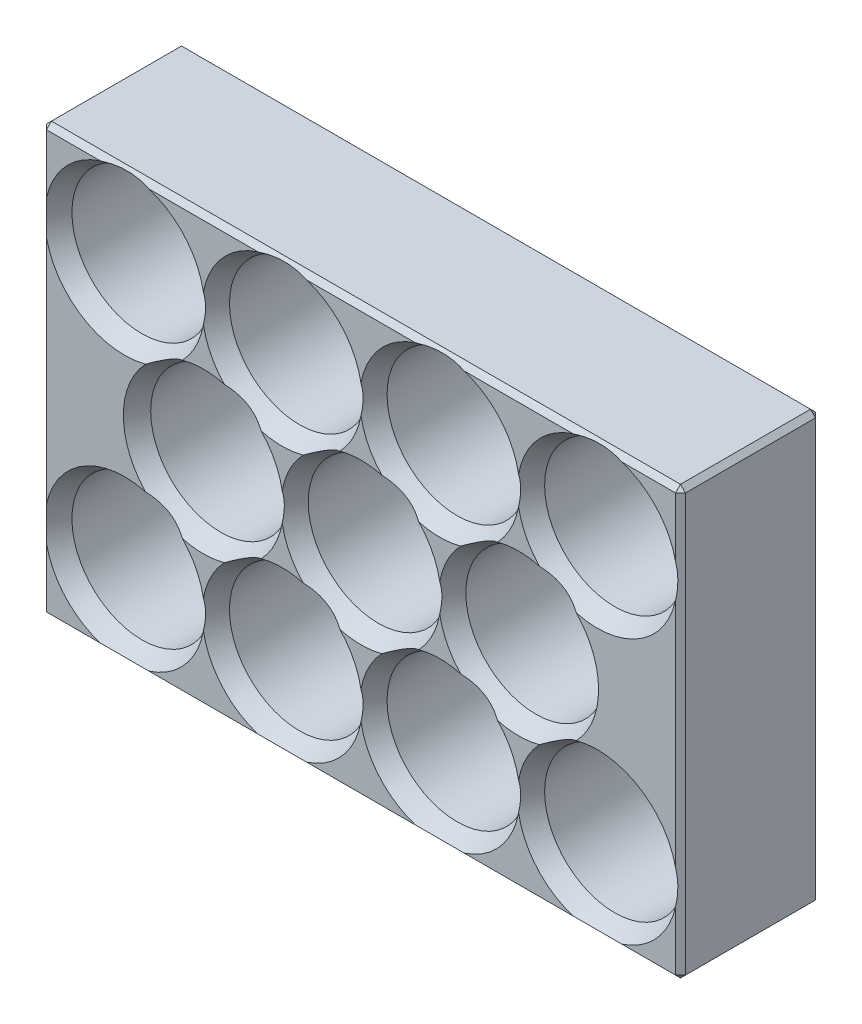
from build123d import *

# Parameters (mm, degrees)
ESQUISSE1_W             = 127.76
ESQUISSE1_H             = 85.48
BOSS_EXTRU_1_DEPTH      = 28
ESQUISSE2_R             = 14
ENL_V_MAT_EXTRU_1_DEPTH = 25
CHANFREIN1_SIZE         = 2
CHANFREIN1_SIZE_2       = 3.464101615


with BuildPart() as part:
    # Esquisse1 → Boss.-Extru.1 (new body)
    with BuildSketch(Plane.XY):
        with Locations((63.88, 42.74)):
            Rectangle(ESQUISSE1_W, ESQUISSE1_H)
    extrude(amount=BOSS_EXTRU_1_DEPTH)

    # Esquisse2 → Enlèv. mat.-Extru.1 (cut)
    with BuildSketch(Plane.XY.offset(28)):
        with Locations((111.13, 69.24)):
            Circle(ESQUISSE2_R)
        with Locations((79.63, 69.24)):
            Circle(ESQUISSE2_R)
        with Locations((48.13, 69.24)):
            Circle(ESQUISSE2_R)
        with Locations((16.63, 69.24)):
            Circle(ESQUISSE2_R)
        with Locations((32.38, 42.74)):
            Circle(ESQUISSE2_R)
        with Locations((16.63, 16.24)):
            Circle(ESQUISSE2_R)
        with Locations((48.13, 16.24)):
            Circle(ESQUISSE2_R)
        with Locations((111.13, 16.24)):
            Circle(ESQUISSE2_R)
        with Locations((79.63, 16.24)):
            Circle(ESQUISSE2_R)
        with Locations((63.88, 42.74)):
            Circle(ESQUISSE2_R)
        with Locations((95.38, 42.74)):
            Circle(ESQUISSE2_R)
    extrude(amount=-ENL_V_MAT_EXTRU_1_DEPTH, mode=Mode.SUBTRACT)

    # Chanfrein1
    # the kernel refuses this chamfer: 3.464101615, 2 mm, written as the material it takes off along each edge
    with BuildSketch(Plane(origin=(79.63, 69.24, 28), x_dir=(1, 0, 0), z_dir=(0, -1, 0))) as chanfrein1_piece_1:
        Polygon((14 + CHANFREIN1_SIZE, 0), (14, -CHANFREIN1_SIZE_2), (14, 0), align=None)
    revolve(axis=Axis((79.63, 69.24, 28), (0, 0, 1)), mode=Mode.SUBTRACT)
    with BuildSketch(Plane(origin=(111.13, 69.24, 28), x_dir=(1, 0, 0), z_dir=(0, -1, 0))) as chanfrein1_piece_2:
        Polygon((14 + CHANFREIN1_SIZE, 0), (14, -CHANFREIN1_SIZE_2), (14, 0), align=None)
    revolve(axis=Axis((111.13, 69.24, 28), (0, 0, 1)), mode=Mode.SUBTRACT)
    with BuildSketch(Plane(origin=(63.88, 42.74, 28), x_dir=(1, 0, 0), z_dir=(0, -1, 0))) as chanfrein1_piece_3:
        Polygon((14 + CHANFREIN1_SIZE, 0), (14, -CHANFREIN1_SIZE_2), (14, 0), align=None)
    revolve(axis=Axis((63.88, 42.74, 28), (0, 0, 1)), mode=Mode.SUBTRACT)
    with BuildSketch(Plane(origin=(95.38, 42.74, 28), x_dir=(1, 0, 0), z_dir=(0, -1, 0))) as chanfrein1_piece_4:
        Polygon((14 + CHANFREIN1_SIZE, 0), (14, -CHANFREIN1_SIZE_2), (14, 0), align=None)
    revolve(axis=Axis((95.38, 42.74, 28), (0, 0, 1)), mode=Mode.SUBTRACT)
    with BuildSketch(Plane(origin=(32.38, 42.74, 28), x_dir=(1, 0, 0), z_dir=(0, -1, 0))) as chanfrein1_piece_5:
        Polygon((14 + CHANFREIN1_SIZE, 0), (14, -CHANFREIN1_SIZE_2), (14, 0), align=None)
    revolve(axis=Axis((32.38, 42.74, 28), (0, 0, 1)), mode=Mode.SUBTRACT)
    with BuildSketch(Plane(origin=(16.63, 16.24, 28), x_dir=(1, 0, 0), z_dir=(0, -1, 0))) as chanfrein1_piece_6:
        Polygon((14 + CHANFREIN1_SIZE, 0), (14, -CHANFREIN1_SIZE_2), (14, 0), align=None)
    revolve(axis=Axis((16.63, 16.24, 28), (0, 0, 1)), mode=Mode.SUBTRACT)
    with BuildSketch(Plane(origin=(16.63, 69.24, 28), x_dir=(1, 0, 0), z_dir=(0, -1, 0))) as chanfrein1_piece_7:
        Polygon((14 + CHANFREIN1_SIZE, 0), (14, -CHANFREIN1_SIZE_2), (14, 0), align=None)
    revolve(axis=Axis((16.63, 69.24, 28), (0, 0, 1)), mode=Mode.SUBTRACT)
    with BuildSketch(Plane(origin=(48.13, 69.24, 28), x_dir=(1, 0, 0), z_dir=(0, -1, 0))) as chanfrein1_piece_8:
        Polygon((14 + CHANFREIN1_SIZE, 0), (14, -CHANFREIN1_SIZE_2), (14, 0), align=None)
    revolve(axis=Axis((48.13, 69.24, 28), (0, 0, 1)), mode=Mode.SUBTRACT)
    with BuildSketch(Plane(origin=(79.63, 16.24, 28), x_dir=(1, 0, 0), z_dir=(0, -1, 0))) as chanfrein1_piece_9:
        Polygon((14 + CHANFREIN1_SIZE, 0), (14, -CHANFREIN1_SIZE_2), (14, 0), align=None)
    revolve(axis=Axis((79.63, 16.24, 28), (0, 0, 1)), mode=Mode.SUBTRACT)
    with BuildSketch(Plane(origin=(111.13, 16.24, 28), x_dir=(1, 0, 0), z_dir=(0, -1, 0))) as chanfrein1_piece_10:
        Polygon((14 + CHANFREIN1_SIZE, 0), (14, -CHANFREIN1_SIZE_2), (14, 0), align=None)
    revolve(axis=Axis((111.13, 16.24, 28), (0, 0, 1)), mode=Mode.SUBTRACT)
    with BuildSketch(Plane(origin=(48.13, 16.24, 28), x_dir=(1, 0, 0), z_dir=(0, -1, 0))) as chanfrein1_piece_11:
        Polygon((14 + CHANFREIN1_SIZE, 0), (14, -CHANFREIN1_SIZE_2), (14, 0), align=None)
    revolve(axis=Axis((48.13, 16.24, 28), (0, 0, 1)), mode=Mode.SUBTRACT)

    # Chanfrein2
    # the kernel refuses this chamfer: 1 mm, written as the material it takes off along each edge
    with BuildSketch(Plane(origin=(127.093333333, 0.666666667, 27.333333333), x_dir=(0.7071067811865476, 0.7071067811865474, 0), z_dir=(0.5773502691896257, -0.5773502691896258, 0.5773502691896258)), Plane(origin=(0.666666667, 84.813333333, 27.333333333), x_dir=(0.7071067811865475, 0, 0.7071067811865476), z_dir=(-0.5773502691896258, 0.5773502691896256, 0.5773502691896257)), Plane(origin=(127.093333333, 84.813333333, 0.666666667), x_dir=(-0.7071067811865476, 0, -0.7071067811865474), z_dir=(0.5773502691896257, 0.5773502691896257, -0.5773502691896258)), Plane(origin=(0.666666667, 0.666666667, 0.666666667), x_dir=(-0.7071067811865475, 0.7071067811865475, 0), z_dir=(-0.5773502691896257, -0.5773502691896257, -0.5773502691896257))) as chanfrein2_piece_1:
        Polygon((-0.707106781, -0.40824829), (0.707106781, -0.40824829), (0, 0.816496581), align=None)
    extrude(amount=1.270170592, mode=Mode.SUBTRACT)
    with BuildSketch(Plane(origin=(127.093333333, 84.813333333, 27.333333333), x_dir=(-0.7071067811865475, 0, 0.7071067811865475), z_dir=(0.5773502691896258, 0.5773502691896258, 0.5773502691896258)), Plane(origin=(0.666666667, 0.666666667, 27.333333333), x_dir=(-0.7071067811865475, 0.7071067811865475, 0), z_dir=(-0.5773502691896258, -0.5773502691896258, 0.5773502691896257)), Plane(origin=(0.666666667, 84.813333333, 0.666666667), x_dir=(0.7071067811865475, 0, -0.7071067811865475), z_dir=(-0.5773502691896258, 0.5773502691896256, -0.5773502691896258)), Plane(origin=(127.093333333, 0.666666667, 0.666666667), x_dir=(0.7071067811865476, 0.7071067811865475, 0), z_dir=(0.5773502691896256, -0.5773502691896258, -0.577350269189626))) as chanfrein2_piece_2:
        Polygon((-0.707106781, 0.40824829), (0.707106781, 0.40824829), (0, -0.816496581), align=None)
    extrude(amount=1.270170592, mode=Mode.SUBTRACT)
    with BuildSketch(Plane(origin=(127.76, -2.571682988, 28), x_dir=(0.0274958766105822, 0, -0.999621916911297), z_dir=(0, 1, 0)), Plane(origin=(0, 88.051682988, 28), x_dir=(-0.02749587661058639, 0, -0.9996219169112968), z_dir=(0, -1, 0))) as chanfrein2_piece_3:
        with BuildLine():
            Line((1.028673195, 0), (-0.056547155, 1.027117794))
            Line((-0.056547155, 1.027117794), (-0.076539593, 1.026567876))
            ThreePointArc((-0.076539593, 1.026567876), (-0.034129227, 0.51339783), (-0.019992438, -0.000549918))
            Line((-0.019992438, -0.000549918), (0.000549918, -0.019992438))
            ThreePointArc((0.000549918, -0.019992438), (0.514497665, -0.00585565), (1.029223113, -0.019992438))
            Line((1.029223113, -0.019992438), (1.028673195, 0))
        make_face()
    extrude(amount=90.623365976, mode=Mode.SUBTRACT)
    with BuildSketch(Plane(origin=(130.331682988, 85.48, 28), x_dir=(0, -0.9996219169112968, 0.02749587661058574), z_dir=(-1, 0, 0)), Plane(origin=(-2.571682988, 0, 0), x_dir=(0, -0.027495876610586372, 0.9996219169112968), z_dir=(1, 0, 0))) as chanfrein2_piece_4:
        with BuildLine():
            Line((1.028673195, 0), (-0.056547155, -1.027117794))
            Line((-0.056547155, -1.027117794), (-0.076539593, -1.026567876))
            ThreePointArc((-0.076539593, -1.026567876), (-0.034129227, -0.51339783), (-0.019992438, 0.000549918))
            Line((-0.019992438, 0.000549918), (0.000549918, 0.019992438))
            ThreePointArc((0.000549918, 0.019992438), (0.514497665, 0.00585565), (1.029223113, 0.019992438))
            Line((1.029223113, 0.019992438), (1.028673195, 0))
        make_face()
    extrude(amount=132.903365976, mode=Mode.SUBTRACT)
    with BuildSketch(Plane(origin=(130.331682988, 85.48, 0), x_dir=(0, -0.9996219169112968, -0.027495876610586483), z_dir=(-1, 0, 0)), Plane(origin=(-2.571682988, 0, 28), x_dir=(0, -0.02749587661058639, -0.9996219169112968), z_dir=(1, 0, 0))) as chanfrein2_piece_5:
        with BuildLine():
            Line((1.028673195, 0), (-0.056547155, 1.027117794))
            Line((-0.056547155, 1.027117794), (-0.076539593, 1.026567876))
            ThreePointArc((-0.076539593, 1.026567876), (-0.034129227, 0.51339783), (-0.019992438, -0.000549918))
            Line((-0.019992438, -0.000549918), (0.000549918, -0.019992438))
            ThreePointArc((0.000549918, -0.019992438), (0.514497665, -0.00585565), (1.029223113, -0.019992438))
            Line((1.029223113, -0.019992438), (1.028673195, 0))
        make_face()
    extrude(amount=132.903365976, mode=Mode.SUBTRACT)
    with BuildSketch(Plane(origin=(127.76, -2.571682988, 0), x_dir=(0.027495876610582174, 0, 0.9996219169112968), z_dir=(0, 1, 0)), Plane(origin=(0, 88.051682988, 0), x_dir=(-0.027495876610586372, 0, 0.9996219169112968), z_dir=(0, -1, 0))) as chanfrein2_piece_6:
        with BuildLine():
            Line((1.028673195, 0), (-0.056547155, -1.027117794))
            Line((-0.056547155, -1.027117794), (-0.076539593, -1.026567876))
            ThreePointArc((-0.076539593, -1.026567876), (-0.034129227, -0.51339783), (-0.019992438, 0.000549918))
            Line((-0.019992438, 0.000549918), (0.000549918, 0.019992438))
            ThreePointArc((0.000549918, 0.019992438), (0.514497665, 0.00585565), (1.029223113, 0.019992438))
            Line((1.029223113, 0.019992438), (1.028673195, 0))
        make_face()
    extrude(amount=90.623365976, mode=Mode.SUBTRACT)
    with BuildSketch(Plane(origin=(0, 85.48, -2.571682988), x_dir=(-0.027495876610586483, -0.9996219169112968, 0), z_dir=(0, 0, 1)), Plane(origin=(0, 0, -2.571682988), x_dir=(0.9996219169112968, -0.027495876610586372, 0), z_dir=(0, 0, 1))) as chanfrein2_piece_7:
        with BuildLine():
            Line((1.028673195, 0), (-0.056547155, 1.027117794))
            Line((-0.056547155, 1.027117794), (-0.076539593, 1.026567876))
            ThreePointArc((-0.076539593, 1.026567876), (-0.034129227, 0.51339783), (-0.019992438, -0.000549918))
            Line((-0.019992438, -0.000549918), (0.000549918, -0.019992438))
            ThreePointArc((0.000549918, -0.019992438), (0.514497665, -0.00585565), (1.029223113, -0.019992438))
            Line((1.029223113, -0.019992438), (1.028673195, 0))
        make_face()
    extrude(amount=33.143365976, mode=Mode.SUBTRACT)
    with BuildSketch(Plane(origin=(127.76, 85.48, -2.571682988), x_dir=(0.02749587661058229, -0.9996219169112968, 0), z_dir=(0, 0, 1)), Plane(origin=(127.76, 0, -2.571682988), x_dir=(-0.9996219169112968, -0.027495876610586483, 0), z_dir=(0, 0, 1))) as chanfrein2_piece_8:
        with BuildLine():
            Line((1.028673195, 0), (-0.056547155, -1.027117794))
            Line((-0.056547155, -1.027117794), (-0.076539593, -1.026567876))
            ThreePointArc((-0.076539593, -1.026567876), (-0.034129227, -0.51339783), (-0.019992438, 0.000549918))
            Line((-0.019992438, 0.000549918), (0.000549918, 0.019992438))
            ThreePointArc((0.000549918, 0.019992438), (0.514497665, 0.00585565), (1.029223113, 0.019992438))
            Line((1.029223113, 0.019992438), (1.028673195, 0))
        make_face()
    extrude(amount=33.143365976, mode=Mode.SUBTRACT)


solid = part.part
